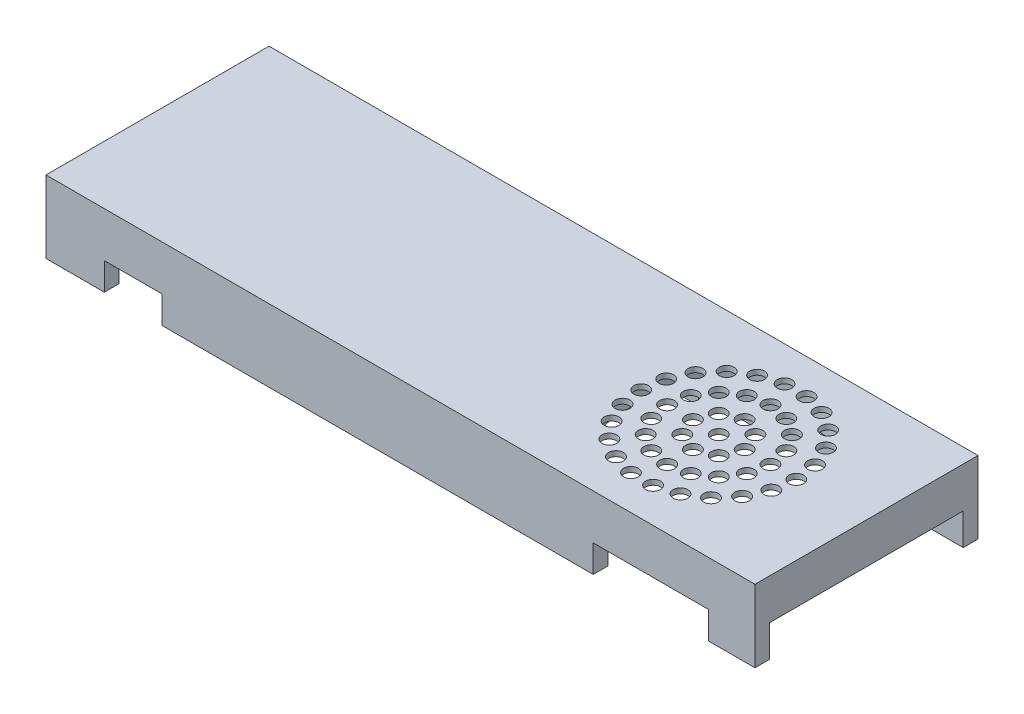
from build123d import *

# Parameters (mm, degrees)
SKETCH_1_W           = 96
SKETCH_1_H           = 30.2
EXTRUDE_1_DEPTH      = 9.8
SKETCH_1_8_W         = 0.1
SKETCH_1_8_H         = 26.2
SKETCH_1_8_W_2       = 94
CUT_EXTRUDE_2_DEPTH  = 4.3
SKETCH_2_R           = 12.7
CUT_EXTRUDE_3_DEPTH  = 4.8
SKETCH_3_W           = 32.4
SKETCH_3_H           = 19.2
CUT_EXTRUDE_4_DEPTH  = 4.8
SKETCH_4_R           = 0.6
CUT_EXTRUDE_5_DEPTH  = 2
SKETCH_5_W           = 7.8
SKETCH_5_H           = 2
SKETCH_5_W_2         = 15.6
CUT_EXTRUDE_6_DEPTH  = 3.7
SKETCH_6_R           = 0.4
CUT_EXTRUDE_7_DEPTH  = 2
SKETCH_7_W           = 12
SKETCH_7_H           = 6.9
SKETCH_7_W_2         = 20
SKETCH_7_H_2         = 2
CUT_EXTRUDE_9_DEPTH  = 1.9
SKETCH_8_W           = 4.8
SKETCH_8_H           = 9.7
CUT_EXTRUDE_10_DEPTH = 2
OTHER_START          = 9.1
OTHER_1_OUTLINE_R    = 1
OTHER_1_DEPTH        = 0.7


# Read off the part's stored shape, not the designer's step: 填充阵列1
with BuildPart() as part:
    # 草图1 → 凸台-拉伸1 (new body)
    with BuildSketch(Plane(origin=(0, 0, 0), x_dir=(1, 0, 0), z_dir=(0, 1, 0))):
        with Locations((-1, 0)):
            Rectangle(SKETCH_1_W, SKETCH_1_H)
    extrude(amount=EXTRUDE_1_DEPTH)

    # 草图1<8> → 切除-拉伸2 (cut)
    with BuildSketch(Plane(origin=(0, 0, 0), x_dir=(1, 0, 0), z_dir=(0, 1, 0))):
        with Locations((-47.05, 0)):
            Rectangle(SKETCH_1_8_W, SKETCH_1_8_H)
        Rectangle(SKETCH_1_8_W_2, SKETCH_1_8_H)
    extrude(amount=CUT_EXTRUDE_2_DEPTH, mode=Mode.SUBTRACT)

    # 草图2 → 切除-拉伸3 (cut)
    with BuildSketch(Plane(origin=(0, 4.3, 0), x_dir=(-1, 0, 0), z_dir=(0, -1, 0))):
        with Locations(Location((-27, 0, 0), (0, 0, 90))):
            Circle(SKETCH_2_R)
    extrude(amount=-CUT_EXTRUDE_3_DEPTH, mode=Mode.SUBTRACT)

    # 草图3 → 切除-拉伸4 (cut)
    with BuildSketch(Plane.XZ.offset(-4.3)):
        with Locations((-6.9, 0)):
            Rectangle(SKETCH_3_W, SKETCH_3_H)
    extrude(amount=-CUT_EXTRUDE_4_DEPTH, mode=Mode.SUBTRACT)

    # 草图4 → 切除-拉伸5 (cut)
    with BuildSketch(Plane.XZ.offset(-4.3)):
        Polygon((-23.1, 7.5), (-47.1, 7.5), (-47.1, -7.5), (-32.1, -7.5), (-32.1, -13.1), (-7.1, -13.1), (-7.1, -9.6), (-23.1, -9.6), align=None)
        with BuildLine():
            Line((37, 13.1), (14, 13.1))
            Line((14, 13.1), (14, 10.1))
            Line((14, 10.1), (19.300649378, 10.1))
            ThreePointArc((19.300649378, 10.1), (27, 12.7), (34.699350622, 10.1))
            Line((34.699350622, 10.1), (37, 10.1))
            Line((37, 10.1), (37, 13.1))
        make_face()
        with BuildLine():
            Line((16.75109762, 7.5), (9.3, 7.5))
            Line((9.3, 7.5), (9.3, -7.5))
            Line((9.3, -7.5), (16.75109762, -7.5))
            ThreePointArc((16.75109762, -7.5), (14.3, 0), (16.75109762, 7.5))
        make_face()
        with Locations(Location((-44, 10, 0), (0, 0, 270))):
            Circle(SKETCH_4_R)
        with Locations(Location((-44, -10, 0), (0, 0, 270))):
            Circle(SKETCH_4_R)
        with Locations(Location((44, 10, 0), (0, 0, 270))):
            Circle(SKETCH_4_R)
        with Locations(Location((44, -10, 0), (0, 0, 270))):
            Circle(SKETCH_4_R)
    extrude(amount=-CUT_EXTRUDE_5_DEPTH, mode=Mode.SUBTRACT)

    # 草图5 → 切除-拉伸6 (cut)
    with BuildSketch(Plane.XZ):
        with Locations((-37.2, 14.1)):
            Rectangle(SKETCH_5_W, SKETCH_5_H)
        with Locations((32.9, 14.1)):
            Rectangle(SKETCH_5_W_2, SKETCH_5_H)
    extrude(amount=-CUT_EXTRUDE_6_DEPTH, mode=Mode.SUBTRACT)

    # 草图6 → 切除-拉伸7 (cut)
    with BuildSketch(Plane.ZY.offset(49)):
        with Locations((-8.05, 4.9)):
            Circle(SKETCH_6_R)
        with Locations((8.05, 4.9)):
            Circle(SKETCH_6_R)
    extrude(amount=-CUT_EXTRUDE_7_DEPTH, mode=Mode.SUBTRACT)

    # 草图7 → 切除-拉伸9 (cut)
    with BuildSketch(Plane.ZY.offset(49)):
        with Locations((0, 3.45)):
            Rectangle(SKETCH_7_W, SKETCH_7_H)
        with Locations((0, 1)):
            Rectangle(SKETCH_7_W_2, SKETCH_7_H_2)
    extrude(amount=-CUT_EXTRUDE_9_DEPTH, mode=Mode.SUBTRACT)

    # 草图8 → 切除-拉伸10 (cut)
    with BuildSketch(Plane.XZ.offset(-6.3)):
        with Locations((-44.7, 2.65)):
            Rectangle(SKETCH_8_W, SKETCH_8_H)
    extrude(amount=-CUT_EXTRUDE_10_DEPTH, mode=Mode.SUBTRACT)

    # 填充阵列1 outline → 填充阵列1 (cut)
    with BuildSketch(Plane(origin=(0, 0, 0), x_dir=(1, 0, 0), z_dir=(0, 1, 0)).offset(OTHER_START)):
        with Locations((27, -3.369e-06)):
            Circle(OTHER_1_OUTLINE_R)
        with Locations((22.050252532, 4.949744099)):
            Circle(OTHER_1_OUTLINE_R)
        with Locations((33.876037706, 7.935367161)):
            Circle(OTHER_1_OUTLINE_R)
        with Locations((20.532843272, 2.678780657)):
            Circle(OTHER_1_OUTLINE_R)
        with Locations((31.361857637, 9.551132582)):
            Circle(OTHER_1_OUTLINE_R)
        with Locations((27, 6.999996631)):
            Circle(OTHER_1_OUTLINE_R)
        with Locations((37.074676223, 2.958188477)):
            Circle(OTHER_1_OUTLINE_R)
        with Locations((24.321215973, 6.467153358)):
            Circle(OTHER_1_OUTLINE_R)
        with Locations((35.833162095, 5.676725214)):
            Circle(OTHER_1_OUTLINE_R)
        with Locations((28.494305802, 10.39312177)):
            Circle(OTHER_1_OUTLINE_R)
        with Locations((25.505694198, 10.39312177)):
            Circle(OTHER_1_OUTLINE_R)
        with Locations((22.638142363, 9.551132582)):
            Circle(OTHER_1_OUTLINE_R)
        with Locations((20.123962294, 7.935367161)):
            Circle(OTHER_1_OUTLINE_R)
        with Locations((18.166837905, 5.676725214)):
            Circle(OTHER_1_OUTLINE_R)
        with Locations((16.925323777, 2.958188477)):
            Circle(OTHER_1_OUTLINE_R)
        with Locations((20.123962294, -7.9353739)):
            Circle(OTHER_1_OUTLINE_R)
        with Locations((24.321215973, -6.467160097)):
            Circle(OTHER_1_OUTLINE_R)
        with Locations((29.474873734, -2.474877104)):
            Circle(OTHER_1_OUTLINE_R)
        with Locations((18.166837905, -5.676731953)):
            Circle(OTHER_1_OUTLINE_R)
        with Locations((29.474873734, 2.474870365)):
            Circle(OTHER_1_OUTLINE_R)
        with Locations((22.638142363, -9.551139321)):
            Circle(OTHER_1_OUTLINE_R)
        with Locations((27, -7.000003369)):
            Circle(OTHER_1_OUTLINE_R)
        with Locations((30.5, -3.369e-06)):
            Circle(OTHER_1_OUTLINE_R)
        with Locations((24.525126266, -2.474877104)):
            Circle(OTHER_1_OUTLINE_R)
        with Locations((16.5, -3.369e-06)):
            Circle(OTHER_1_OUTLINE_R)
        with Locations((20, -3.369e-06)):
            Circle(OTHER_1_OUTLINE_R)
        with Locations((23.5, -3.369e-06)):
            Circle(OTHER_1_OUTLINE_R)
        with Locations((22.050252532, -4.949750838)):
            Circle(OTHER_1_OUTLINE_R)
        with Locations((27, -3.500003369)):
            Circle(OTHER_1_OUTLINE_R)
        with Locations((16.925323777, -2.958195216)):
            Circle(OTHER_1_OUTLINE_R)
        with Locations((20.532843272, -2.678787396)):
            Circle(OTHER_1_OUTLINE_R)
        with Locations((35.833162095, -5.676731953)):
            Circle(OTHER_1_OUTLINE_R)
        with Locations((33.467156728, 2.678780657)):
            Circle(OTHER_1_OUTLINE_R)
        with Locations((33.876037706, -7.9353739)):
            Circle(OTHER_1_OUTLINE_R)
        with Locations((34, -3.369e-06)):
            Circle(OTHER_1_OUTLINE_R)
        with Locations((37.5, -3.369e-06)):
            Circle(OTHER_1_OUTLINE_R)
        with Locations((29.678784027, 6.467153358)):
            Circle(OTHER_1_OUTLINE_R)
        with Locations((37.074676223, -2.958195216)):
            Circle(OTHER_1_OUTLINE_R)
        with Locations((31.949747468, 4.949744099)):
            Circle(OTHER_1_OUTLINE_R)
        with Locations((31.949747468, -4.949750838)):
            Circle(OTHER_1_OUTLINE_R)
        with Locations((27, 3.499996631)):
            Circle(OTHER_1_OUTLINE_R)
        with Locations((25.505694198, -10.393128509)):
            Circle(OTHER_1_OUTLINE_R)
        with Locations((29.678784027, -6.467160097)):
            Circle(OTHER_1_OUTLINE_R)
        with Locations((28.494305802, -10.393128509)):
            Circle(OTHER_1_OUTLINE_R)
        with Locations((24.525126266, 2.474870365)):
            Circle(OTHER_1_OUTLINE_R)
        with Locations((33.467156728, -2.678787396)):
            Circle(OTHER_1_OUTLINE_R)
        with Locations((31.361857637, -9.551139321)):
            Circle(OTHER_1_OUTLINE_R)
    extrude(amount=OTHER_1_DEPTH, mode=Mode.SUBTRACT)


solid = part.part
